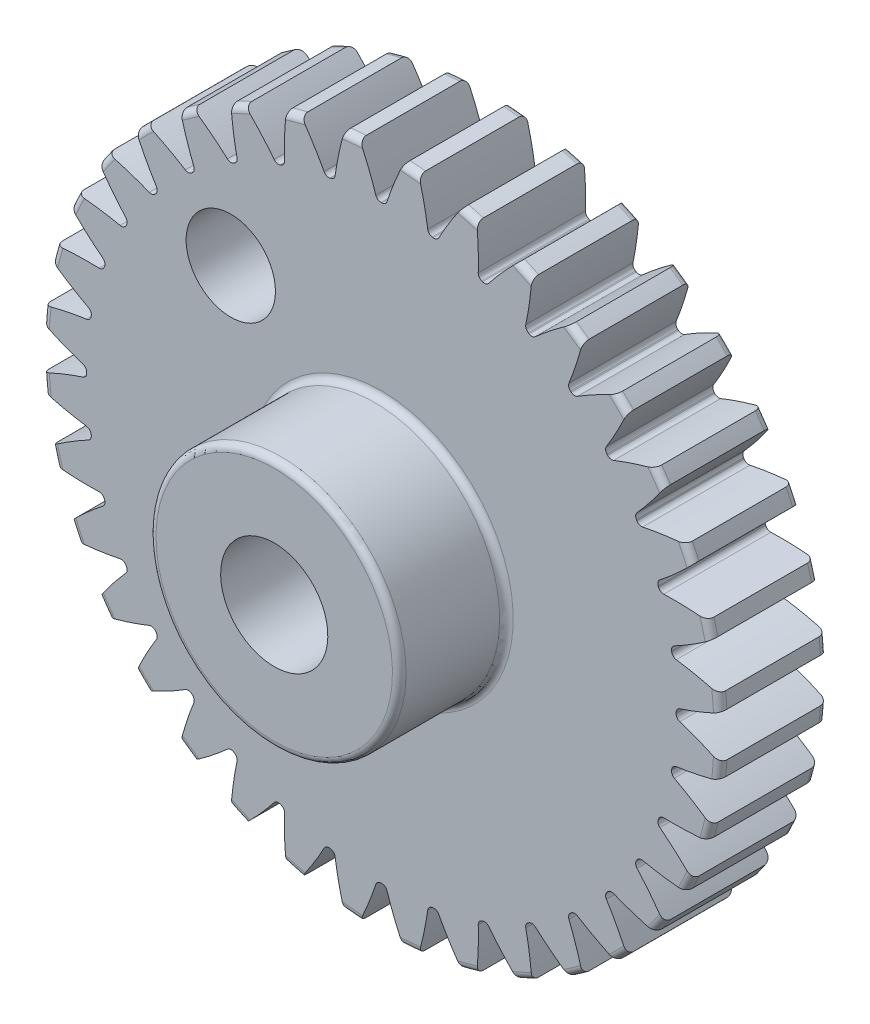
from build123d import *

# Parameters (mm, degrees)
FILLET2_R          = 0.38
CUT_EXTRUDE2_DEPTH = 28.531799796
CIRPATTERN1_COUNT  = 36
SKETCH8_R          = 2.5
CUT_EXTRUDE3_DEPTH = 28.477273123


with BuildPart() as part:
    # Sketch4 → Revolve1 (revolve)
    with BuildSketch(Plane(origin=(0, 0, 0), x_dir=(0, 0, -1), z_dir=(1, 0, 0))):
        Polygon((-12, 3), (-12, 7), (-6, 7), (-6, 19), (0, 19), (0, 3), align=None)
    revolve(axis=Axis((0, 0, 6), (0, 0, 1)))

    # Fillet2
    fillet2_edges = [part.edges().sort_by_distance(p)[0] for p in [
        (0, -7, 12),
        (0, -7, 6),
        (0, -19, 6),
        (0, -19, 0),
    ]]
    fillet(fillet2_edges, radius=FILLET2_R)

    # Sketch7 → Cut-Extrude2 (cut, through all)
    with BuildSketch(Plane.XY.offset(6)):
        with BuildLine():
            ThreePointArc((-0.026603161, 16.499978554), (0, 16.5), (0.026603161, 16.499978554))
            ThreePointArc((0.026603161, 16.499978554), (0.20288747, 16.556880155), (0.312154737, 16.706461619))
            ThreePointArc((0.312154737, 16.706461619), (0.730288505, 17.848903583), (1.224636785, 18.960492207))
            ThreePointArc((1.224636785, 18.960492207), (0, 19), (-1.224636785, 18.960492207))
            ThreePointArc((-1.224636785, 18.960492207), (-0.730288505, 17.848903583), (-0.312154737, 16.706461619))
            ThreePointArc((-0.312154737, 16.706461619), (-0.20288747, 16.556880155), (-0.026603161, 16.499978554))
        make_face()
    cut_extrude2 = extrude(amount=-CUT_EXTRUDE2_DEPTH, mode=Mode.SUBTRACT)

    # CirPattern1: Cut-Extrude2 ×36 about axis
    cirpattern1_axis = Axis((0, 0, 12), (0, 0, -1))
    for i in range(1, CIRPATTERN1_COUNT):
        add(cut_extrude2.rotate(cirpattern1_axis, i * 360 / CIRPATTERN1_COUNT), mode=Mode.SUBTRACT)

    # Sketch8 → Cut-Extrude3 (cut, through all)
    with BuildSketch(Plane.XY.offset(6)):
        with Locations((-8.432689828, 9.227119933)):
            Circle(SKETCH8_R)
    extrude(amount=-CUT_EXTRUDE3_DEPTH, mode=Mode.SUBTRACT)


solid = part.part
